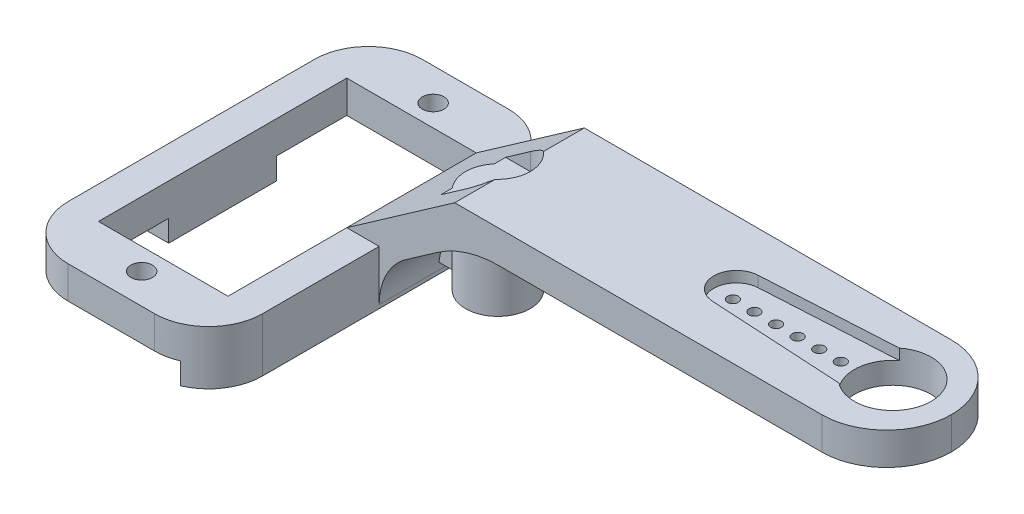
from build123d import *

# Parameters (mm, degrees)
BOSS_EXTRUDE1_DEPTH     = 3
SKETCH1_7_R             = 0.5
BOSS_EXTRUDE2_DEPTH     = 2
BOSS_EXTRUDE4_REACH     = 44.227
SKETCH4_W               = 3
SKETCH4_H               = 12
BOSS_EXTRUDE5_DEPTH     = 5
FILLET3_R               = 10
BOSS_EXTRUDE11_START    = -17
BOSS_EXTRUDE11_DEPTH    = 32.8
SKETCH12_R              = 1
SKETCH12_W              = 12
SKETCH12_H              = 23
CUT_EXTRUDE2_DEPTH      = 48.02396982
FILLET7_R               = 6
FILLET8_R               = 6
SKETCH13_W              = 3
SKETCH13_H              = 10
BOSS_EXTRUDE12_DEPTH    = 2
FILLET9_R               = 5
BOSS_EXTRUDE13_START    = -8
SKETCH1_9_R             = 3
SKETCH1_9_R_2           = 2
BOSS_EXTRUDE13_DEPTH    = 8
CUT_EXTRUDE3_DEPTH      = 8
CUT_EXTRUDE3_DEPTH_BACK = 8
SKETCH1_10_R            = 2
SKETCH1_10_R_2          = 1.15
BOSS_EXTRUDE14_START    = -1
SKETCH1_11_R            = 2
BOSS_EXTRUDE14_DEPTH    = 1
SKETCH1_12_R            = 3
CUT_EXTRUDE4_DEPTH      = 5
SKETCH1_13_R            = 1.15
CUT_EXTRUDE5_DEPTH      = 5
SKETCH17_W              = 11.286302552
SKETCH17_H              = 6
CUT_EXTRUDE6_DEPTH      = 6
BOSS_EXTRUDE15_START    = -3.840535
SKETCH18_W              = 2.041960109
SKETCH18_H              = 1
BOSS_EXTRUDE15_DEPTH    = 3.840535


# Read off the part's stored shape, not the designer's step: Boss-Extrude11
# Some blends are built 0.0001 mm under size
with BuildPart() as part:
    # Sketch1 → Boss-Extrude1 (new body)
    with BuildSketch(Plane(origin=(0, 0, 0), x_dir=(1, 0, 0), z_dir=(0, 1, 0))):
        with BuildLine():
            Line((40.375241408, 5.866153579), (0.375241408, 5.866153579))
            Line((0.375241408, 5.866153579), (0.375241408, 2.102221557))
            ThreePointArc((0.375241408, 2.102221557), (1.113854196, 1.090898451), (1.375241408, -0.133846421))
            ThreePointArc((1.375241408, -0.133846421), (1.113854196, -1.358591292), (0.375241408, -2.369914398))
            Line((0.375241408, -2.369914398), (0.375241408, -6.133846421))
            Line((0.375241408, -6.133846421), (40.375241408, -6.133846421))
            Line((40.375241408, -6.133846421), (40.375241408, 5.866153579))
        make_face()
        with BuildLine():
            Line((32.622415803, -2.8), (20.221989119, -2.1))
            ThreePointArc((20.221989119, -2.1), (18.237190195, 0), (20.221989119, 2.1))
            Line((20.221989119, 2.1), (32.622415803, 2.8))
            ThreePointArc((32.622415803, 2.8), (36.374444489, 3.199023384), (38.375241408, 0))
            ThreePointArc((38.375241408, 0), (36.374444489, -3.199023384), (32.622415803, -2.8))
        make_face(mode=Mode.SUBTRACT)
    extrude(amount=BOSS_EXTRUDE1_DEPTH)

    # Sketch1<7> → Boss-Extrude2 (add)
    with BuildSketch(Plane(origin=(0, 0, 0), x_dir=(1, 0, 0), z_dir=(0, 1, 0))):
        with BuildLine():
            ThreePointArc((20.221989119, 2.1), (18.237190195, 0), (20.221989119, -2.1))
            Line((20.221989119, -2.1), (32.622415803, -2.8))
            ThreePointArc((32.622415803, -2.8), (31.259607239, 0), (32.622415803, 2.8))
            Line((32.622415803, 2.8), (20.221989119, 2.1))
        make_face()
        with Locations(Location((20.005781193, 0, 0), (0, 0, 270))):
            Circle(SKETCH1_7_R, mode=Mode.SUBTRACT)
        with Locations(Location((22.005781193, 0, 0), (0, 0, 270))):
            Circle(SKETCH1_7_R, mode=Mode.SUBTRACT)
        with Locations(Location((24.005781193, 0, 0), (0, 0, 270))):
            Circle(SKETCH1_7_R, mode=Mode.SUBTRACT)
        with Locations(Location((26.005781193, 0, 0), (0, 0, 270))):
            Circle(SKETCH1_7_R, mode=Mode.SUBTRACT)
        with Locations(Location((28.005781193, 0, 0), (0, 0, 270))):
            Circle(SKETCH1_7_R, mode=Mode.SUBTRACT)
        with Locations(Location((30.005781193, 0, 0), (0, 0, 270))):
            Circle(SKETCH1_7_R, mode=Mode.SUBTRACT)
    extrude(amount=BOSS_EXTRUDE2_DEPTH)

    # Boss-Extrude4: up to this face of the body (flat: up to its plane)
    boss_extrude4_end = Plane(part.part.faces().sort_by_distance((20.375241408, 1.5, -5.866153579))[0])
    # Sketch3 → Boss-Extrude4 (add, up to the picked face)
    with BuildSketch(Plane.XY.offset(6.133846421), mode=Mode.PRIVATE) as boss_extrude4_sk1:
        Polygon((0.375241408, 3), (-9.624758592, -4), (-4.393377613, -4), (5.606622387, 3), align=None)
    boss_extrude4_tool1 = split(extrude(boss_extrude4_sk1.sketch, amount=-BOSS_EXTRUDE4_REACH, mode=Mode.PRIVATE), bisect_by=boss_extrude4_end, keep=Keep.BOTH, mode=Mode.PRIVATE)
    add(boss_extrude4_tool1.solids().sort_by(Axis((-2.009068, -0.5, 6.133846), (0, 0, -1)))[0])

    # Sketch4 → Boss-Extrude5 (add)
    with BuildSketch(Plane(origin=(0, -4, 0), x_dir=(-1, 0, 0), z_dir=(0, -1, 0))):
        with Locations((8.124758592, -0.133846421)):
            Rectangle(SKETCH4_W, SKETCH4_H)
    extrude(amount=BOSS_EXTRUDE5_DEPTH)

    # Fillet3
    # the kernel refuses this fillet: 10 mm, written as the material it adds along each edge
    with BuildSketch(Plane(origin=(1.320908101, 0, 6.133846421), x_dir=(1, 0, 0), z_dir=(0, 0, -1))) as fillet3_piece_1_section:
        with BuildLine():
            CenterArc((FILLET3_R * 0.315222230819, FILLET3_R), FILLET3_R, 235.007979801, 34.992020199)
            Line((-FILLET3_R * 0.258240113544, FILLET3_R * 0.180768079481), (0, 0))
            Line((0, 0), (FILLET3_R * 0.315222230819, 0))
        make_face()
    fillet3_piece_1 = extrude(amount=13.312182885, mode=Mode.PRIVATE)
    fillet3_piece_1 = split(fillet3_piece_1, bisect_by=Plane(origin=(1.586628452, -0.313093782, -5.866153579), z_dir=(0, 0, 1)), keep=Keep.TOP, mode=Mode.PRIVATE)
    fillet3_piece_1 = fillet3_piece_1 - Plane(origin=(-1.624758592, -0.313093782, 0.133846421), x_dir=(0.6666666666666657, 0, -0.7453559924999308), z_dir=(0, -1, 0)) * Cylinder(3, 40, mode=Mode.PRIVATE)
    add(fillet3_piece_1)
    with BuildSketch(Plane(origin=(1.320908101, 0, 7.446029306), x_dir=(1, 0, 0), z_dir=(0, 0, -1))) as fillet3_piece_2_section:
        with BuildLine():
            CenterArc((FILLET3_R * 0.315222230819, FILLET3_R), FILLET3_R, 235.007979801, 34.992020199)
            Line((-FILLET3_R * 0.258240113544, FILLET3_R * 0.180768079481), (0, 0))
            Line((0, 0), (FILLET3_R * 0.315222230819, 0))
        make_face()
    fillet3_piece_2 = extrude(amount=13.312182885, mode=Mode.PRIVATE)
    fillet3_piece_2 = split(fillet3_piece_2, bisect_by=Plane(origin=(1.586628452, -0.313093782, 6.133846421), z_dir=(0, 0, -1)), keep=Keep.TOP, mode=Mode.PRIVATE)
    fillet3_piece_2 = fillet3_piece_2 - Plane(origin=(-1.624758592, -0.313093782, 0.133846421), x_dir=(0.6666666666666657, 0, -0.7453559924999308), z_dir=(0, -1, 0)) * Cylinder(3, 40, mode=Mode.PRIVATE)
    add(fillet3_piece_2)

    # Boss-Extrude11 outline → Boss-Extrude11 (add)
    with BuildSketch(Plane.XY.offset(6.133846421).offset(BOSS_EXTRUDE11_START)):
        Polygon((-9.624758592, -7), (-9.624758592, -9), (-6.624758592, -9), (-6.624758592, -4), (-24.624758592, -4), (-24.624758592, -7), align=None)
    extrude(amount=BOSS_EXTRUDE11_DEPTH)

    # Sketch12 → Cut-Extrude2 (cut, through all)
    with BuildSketch(Plane(origin=(0, -7, 0), x_dir=(-1, 0, 0), z_dir=(0, -1, 0))):
        with Locations(Location((15.624758592, -19.133846421, 0), (0, 0, 180))):
            Circle(SKETCH12_R)
        with Locations(Location((15.624758592, 7.866153579, 0), (0, 0, 180))):
            Circle(SKETCH12_R)
        with Locations((15.624758592, -5.633846421)):
            Rectangle(SKETCH12_W, SKETCH12_H)
    extrude(amount=-CUT_EXTRUDE2_DEPTH, mode=Mode.SUBTRACT)

    # Fillet7
    fillet7_edges = [part.edges().sort_by_distance(p)[0] for p in [
        (40.375241408, 1.5, -5.866153579),
        (40.375241408, 1.5, 6.133846421),
    ]]
    fillet(fillet7_edges, radius=FILLET7_R - 0.0001)  # a hair under: the kernel refuses the full size

    # Fillet8
    # the kernel refuses this fillet: 6 mm, written as the material it adds along each edge
    with BuildSketch(Plane(origin=(-6.624758592, -4, -5.866153579), x_dir=(1, 0, 0), z_dir=(0, 0, 1))) as fillet8_piece_1:
        with BuildLine():
            CenterArc((6, -4.668780426), FILLET8_R, 128.910316117, 51.089683883)
            Line((0, -4.668780426), (0, 0))
            Line((0, 0), (2.231380978, 0))
        make_face()
    extrude(amount=12)

    # Sketch13 → Boss-Extrude12 (add)
    with BuildSketch(Plane.XZ.offset(7)):
        with Locations((-23.124758592, 5.633846421)):
            Rectangle(SKETCH13_W, SKETCH13_H)
    extrude(amount=BOSS_EXTRUDE12_DEPTH)

    # Fillet9
    # the kernel refuses this fillet: 5 mm, written as the material it takes off along each edge
    with BuildSketch(Plane(origin=(-6.624758592, -21.5, -10.866153579), x_dir=(0, 0, 1), z_dir=(0, 1, 0))) as fillet9_piece_1:
        with BuildLine():
            CenterArc((FILLET9_R, -FILLET9_R), FILLET9_R, 90, 90)
            Line((0, -FILLET9_R), (0, 0))
            Line((0, 0), (FILLET9_R, 0))
        make_face()
    extrude(amount=30, mode=Mode.SUBTRACT)
    with BuildSketch(Plane(origin=(-24.624758592, 8.5, -10.866153579), x_dir=(1, 0, 0), z_dir=(0, -1, 0))) as fillet9_piece_2:
        with BuildLine():
            CenterArc((FILLET9_R, FILLET9_R), FILLET9_R, 180, 90)
            Line((0, FILLET9_R), (0, 0))
            Line((0, 0), (FILLET9_R, 0))
        make_face()
    extrude(amount=28, mode=Mode.SUBTRACT)
    with BuildSketch(Plane(origin=(-24.624758592, 8.5, 21.933846421), x_dir=(1, 0, 0), z_dir=(0, -1, 0))) as fillet9_piece_3:
        with BuildLine():
            CenterArc((FILLET9_R, -FILLET9_R), FILLET9_R, 90, 90)
            Line((0, -FILLET9_R), (0, 0))
            Line((0, 0), (FILLET9_R, 0))
        make_face()
    extrude(amount=28, mode=Mode.SUBTRACT)
    with BuildSketch(Plane(origin=(-6.624758592, -21.5, 21.933846421), x_dir=(0, 0, -1), z_dir=(0, 1, 0))) as fillet9_piece_4:
        with BuildLine():
            CenterArc((FILLET9_R, FILLET9_R), FILLET9_R, 180, 90)
            Line((0, FILLET9_R), (0, 0))
            Line((0, 0), (FILLET9_R, 0))
        make_face()
    extrude(amount=30, mode=Mode.SUBTRACT)

    # Sketch1<9> → Boss-Extrude13 (add)
    with BuildSketch(Plane(origin=(0, 0, 0), x_dir=(1, 0, 0), z_dir=(0, 1, 0)).offset(BOSS_EXTRUDE13_START)):
        with Locations(Location((-1.624758592, -0.133846421, 0), (0, 0, 270))):
            Circle(SKETCH1_9_R)
        with Locations(Location((-1.624758592, -0.133846421, 0), (0, 0, 270))):
            Circle(SKETCH1_9_R_2, mode=Mode.SUBTRACT)
    extrude(amount=BOSS_EXTRUDE13_DEPTH)

    # Sketch1<10> → Cut-Extrude3 (cut, two sides: drawn at the far end of the back side and taken through both)
    with BuildSketch(Plane(origin=(0, 0, 0), x_dir=(1, 0, 0), z_dir=(0, 1, 0)).offset(-CUT_EXTRUDE3_DEPTH_BACK)):
        with Locations(Location((-1.624758592, -0.133846421, 0), (0, 0, 270))):
            Circle(SKETCH1_10_R)
        with Locations((-1.624758592, -0.133846421)):
            Circle(SKETCH1_10_R_2)
    extrude(amount=CUT_EXTRUDE3_DEPTH + CUT_EXTRUDE3_DEPTH_BACK, mode=Mode.SUBTRACT)

    # Sketch1<11> → Boss-Extrude14 (add)
    with BuildSketch(Plane(origin=(0, 0, 0), x_dir=(1, 0, 0), z_dir=(0, 1, 0)).offset(BOSS_EXTRUDE14_START)):
        with Locations(Location((-1.624758592, -0.133846421, 0), (0, 0, 270))):
            Circle(SKETCH1_11_R)
    extrude(amount=BOSS_EXTRUDE14_DEPTH)

    # Sketch1<12> → Cut-Extrude4 (cut)
    with BuildSketch(Plane(origin=(0, 0, 0), x_dir=(1, 0, 0), z_dir=(0, 1, 0))):
        with Locations(Location((-1.624758592, -0.133846421, 0), (0, 0, 270))):
            Circle(SKETCH1_12_R)
    extrude(amount=CUT_EXTRUDE4_DEPTH, mode=Mode.SUBTRACT)

    # Sketch1<13> → Cut-Extrude5 (cut)
    with BuildSketch(Plane(origin=(0, 0, 0), x_dir=(1, 0, 0), z_dir=(0, 1, 0))):
        with Locations(Location((-1.624758592, -0.133846421, 0), (0, 0, 270))):
            Circle(SKETCH1_13_R)
    extrude(amount=-CUT_EXTRUDE5_DEPTH, mode=Mode.SUBTRACT)

    # Sketch17 → Cut-Extrude6 (cut)
    with BuildSketch(Plane(origin=(0, 0, 0), x_dir=(1, 0, 0), z_dir=(0, 1, 0))):
        with Locations((-7.267909868, -0.133846421)):
            Rectangle(SKETCH17_W, SKETCH17_H)
    extrude(amount=CUT_EXTRUDE6_DEPTH, mode=Mode.SUBTRACT)

    # Sketch18 → Boss-Extrude15 (add)
    with BuildSketch(Plane(origin=(0, -8, 0), x_dir=(-1, 0, 0), z_dir=(0, -1, 0)).offset(BOSS_EXTRUDE15_START)):
        with Locations((5.603778538, -0.133846421)):
            Rectangle(SKETCH18_W, SKETCH18_H)
    extrude(amount=BOSS_EXTRUDE15_DEPTH)


solid = part.part
